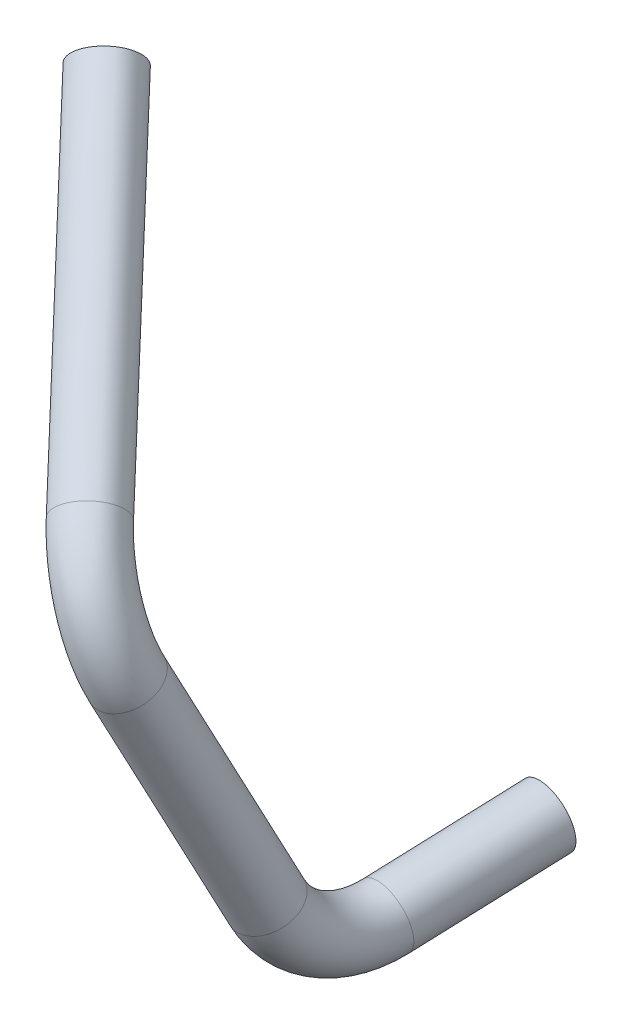
from build123d import *

# Parameters (mm, degrees)
SWEEP_SOTTILE1_PROFILE_R   = 3.175
SWEEP_SOTTILE1_PROFILE_R_2 = 2.175


with BuildPart() as part:
    # Sweep-Sottile1: sweep along a curve in space
    with BuildLine() as sweep_sottile1_path:
        Line((116.408047252, -1.88444996, -10.309126729), (125.352256313, -9.549154154, -0.639016394))
        Line((125.352256313, -9.549154154, -0.639016394), (137.741775896, -20.166303424, 12.756021731))
        ThreePointArc((137.741775896, -20.166303424, 12.756021731), (141.253637853, -24.858685281, 15.364907163), (143.211421386, -30.892468662, 14.406550845))
        Line((143.211421386, -30.892468662, 14.406550845), (146.575907106, -54.520963253, 3.399586113))
        ThreePointArc((148.404013416, -60.058276973, -7.048770661), (147.508521237, -59.043943378, -0.891606357), (146.575907106, -54.520963253, 3.399586113))
        Line((148.69331242, -59.668589131, -9.476878102), (148.404013416, -60.058276973, -7.048770661))
        Line((150.177114329, -57.669897275, -21.930534704), (148.69331242, -59.668589131, -9.476878102))
    # Sweep-Sottile1 profile (on start of the path) → Sweep-Sottile1 (sweep)
    with BuildSketch(Plane(origin=(116.408047252, -1.88444996, -10.309126729), x_dir=(0.7341237723464642, 0, -0.67901567498534), z_dir=(0.586890358326347, -0.5029333460568535, 0.6345216755380618))):
        Circle(SWEEP_SOTTILE1_PROFILE_R)
        Circle(SWEEP_SOTTILE1_PROFILE_R_2, mode=Mode.SUBTRACT)
    sweep(path=sweep_sottile1_path.line)


solid = part.part
